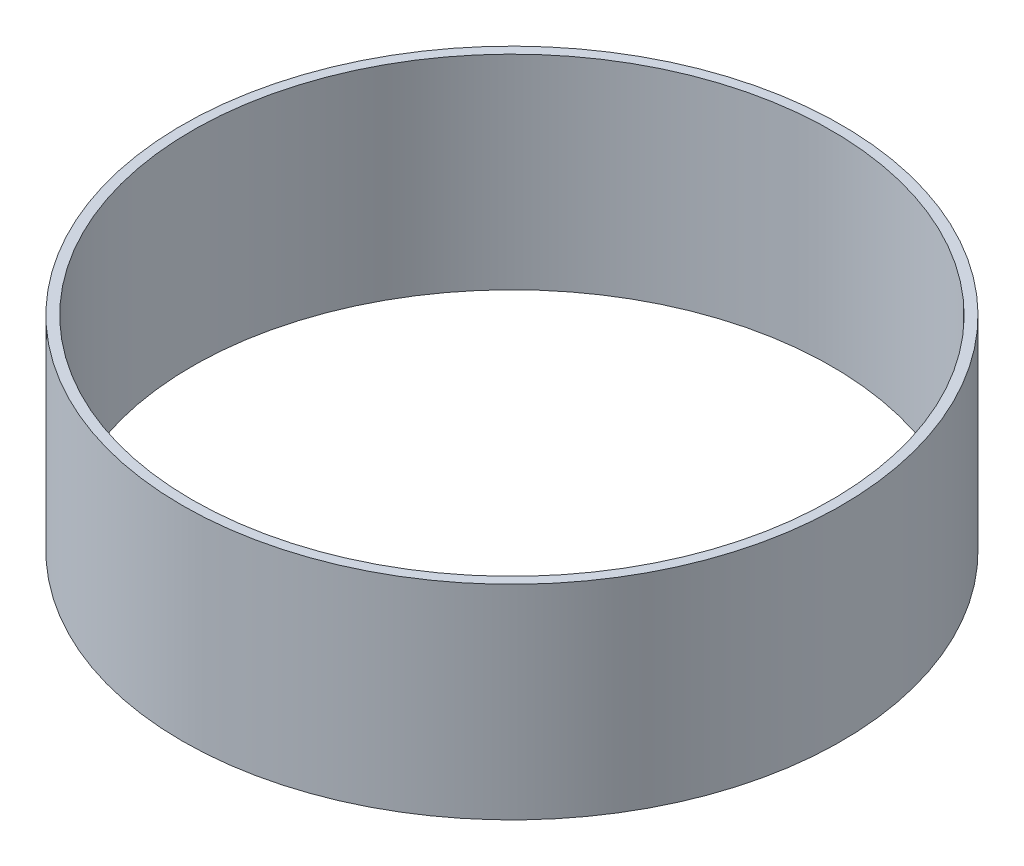
from build123d import *

# Parameters (mm, degrees)
BOSS_EXTRUDE1_DEPTH      = 25
BOSS_EXTRUDE1_DEPTH_BACK = 25
SKETCH1_R                = 80.75
SKETCH1_R_2              = 78.35


with BuildPart() as part:
    # Sketch1 → Boss-Extrude1 (new, two sides: drawn at the far end of the back side and taken through both)
    with BuildSketch(Plane(origin=(0, 0, 0), x_dir=(1, 0, 0), z_dir=(0, 1, 0)).offset(-BOSS_EXTRUDE1_DEPTH_BACK)):
        Circle(SKETCH1_R)
        Circle(SKETCH1_R_2, mode=Mode.SUBTRACT)
    extrude(amount=BOSS_EXTRUDE1_DEPTH + BOSS_EXTRUDE1_DEPTH_BACK)


solid = part.part
